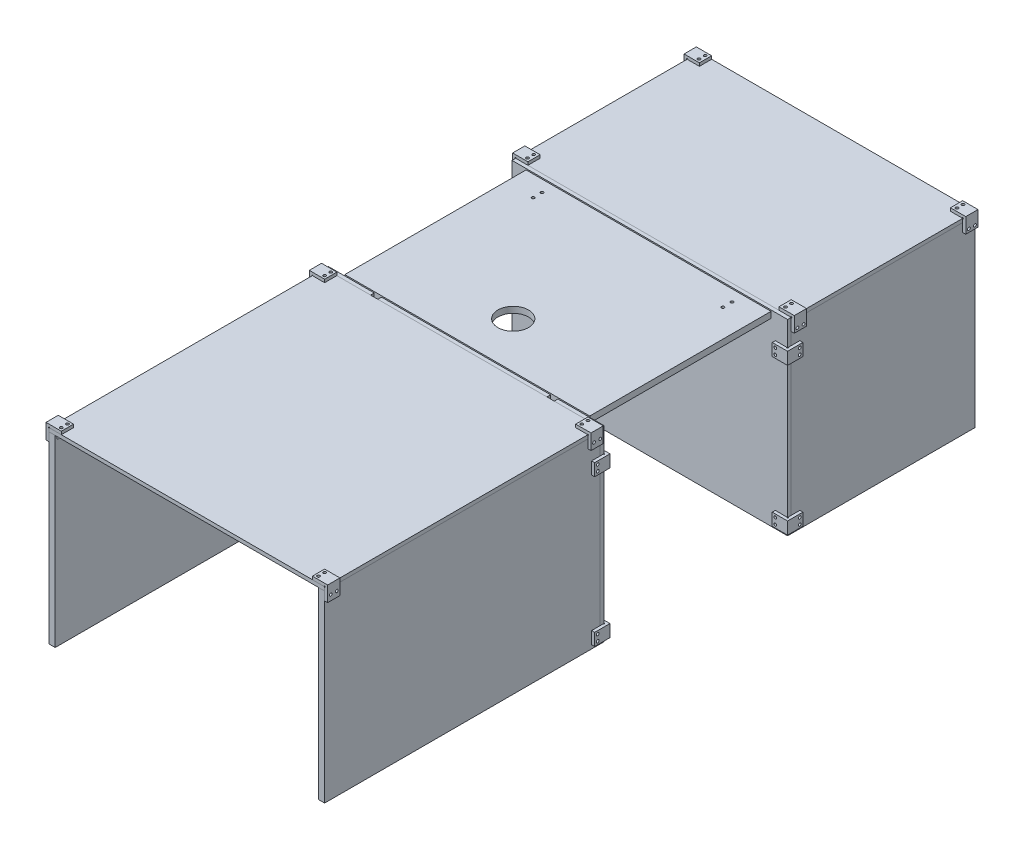
from build123d import *

# Parameters (mm, degrees)
SKETCH1_W                 = 450
SKETCH1_H                 = 300
BOSS_EXTRUDE1_DEPTH       = 10
SKETCH1_W_2               = 300
BOSS_EXTRUDE1_2_DEPTH     = 10
SKETCH1_3_W               = 450
SKETCH1_3_H               = 6
BOSS_EXTRUDE2_DEPTH       = 450
SKETCH1_3_W_2             = 300
BOSS_EXTRUDE2_2_DEPTH     = 450
BOSS_EXTRUDE3_START       = 450
SKETCH1_4_W               = 450
SKETCH1_4_H               = 300
BOSS_EXTRUDE3_DEPTH       = 10
SKETCH1_4_W_2             = 300
BOSS_EXTRUDE3_2_DEPTH     = 10
BOSS_EXTRUDE4_DEPTH       = 450
BOSS_EXTRUDE4_2_DEPTH     = 450
BOSS_EXTRUDE5_DEPTH       = 200
BOSS_EXTRUDE5_DEPTH_BACK  = 200
SKETCH2_W                 = 296
SKETCH2_H                 = 10
BOSS_EXTRUDE6_DEPTH       = 20
BOSS_EXTRUDE6_2_DEPTH     = 20
BOSS_EXTRUDE7_START       = -430
BOSS_EXTRUDE7_DEPTH       = 20
BOSS_EXTRUDE7_2_DEPTH     = 20
BOSS_EXTRUDE8_START       = -1062
BOSS_EXTRUDE8_DEPTH       = 20
BOSS_EXTRUDE8_2_DEPTH     = 20
BOSS_EXTRUDE9_START       = -762
BOSS_EXTRUDE9_DEPTH       = 20
BOSS_EXTRUDE9_2_DEPTH     = 20
BOSS_EXTRUDE10_START      = -40
BOSS_EXTRUDE10_DEPTH      = 20
BOSS_EXTRUDE10_2_DEPTH    = 20
BOSS_EXTRUDE10_3_DEPTH    = 20
BOSS_EXTRUDE10_4_DEPTH    = 20
BOSS_EXTRUDE11_START      = -300
BOSS_EXTRUDE11_DEPTH      = 20
BOSS_EXTRUDE11_2_DEPTH    = 20
BOSS_EXTRUDE11_3_DEPTH    = 20
BOSS_EXTRUDE11_4_DEPTH    = 20
CUT_EXTRUDE1_DEPTH        = 1197.490702012
CUT_EXTRUDE1_DEPTH_BACK   = 1197.490702012
SKETCH6_R                 = 2.25
CUT_EXTRUDE2_DEPTH        = 1196.200819946
CUT_EXTRUDE2_DEPTH_BACK   = 1196.200819946
SKETCH7_R                 = 2.25
CUT_EXTRUDE3_DEPTH        = 820.134909523
CUT_EXTRUDE3_DEPTH_BACK   = 820.134909523
SKETCH8_R                 = 2.25
BOSS_EXTRUDE12_START      = 150
SKETCH9_R                 = 5
SKETCH9_R_2               = 3.15
BOSS_EXTRUDE12_DEPTH      = 10
BOSS_EXTRUDE13_START      = 150
SKETCH9_3_R               = 5
SKETCH9_3_R_2             = 3.15
BOSS_EXTRUDE13_DEPTH      = 10
BOSS_EXTRUDE14_START      = -150
SKETCH9_4_R               = 5
SKETCH9_4_R_2             = 3.15
BOSS_EXTRUDE14_DEPTH      = 10
BOSS_EXTRUDE15_START      = -150
SKETCH9_5_R               = 5
SKETCH9_5_R_2             = 3.15
BOSS_EXTRUDE15_DEPTH      = 10
FILLET1_R                 = 10
FILLET2_R                 = 10
FILLET3_R                 = 10
FILLET4_R                 = 10
BOSS_EXTRUDE16_DEPTH      = 10
BOSS_EXTRUDE16_DEPTH_BACK = 10
CUT_EXTRUDE4_START        = 150
SKETCH11_W                = 6
SKETCH11_H                = 30
CUT_EXTRUDE4_DEPTH        = 12
CUT_EXTRUDE5_START        = -150
SKETCH11_2_W              = 6
SKETCH11_2_H              = 30
CUT_EXTRUDE5_DEPTH        = 12
BOSS_EXTRUDE17_START      = 139
BOSS_EXTRUDE17_DEPTH      = 10
BOSS_EXTRUDE18_START      = -139
BOSS_EXTRUDE18_DEPTH      = 10
SKETCH13_R                = 2.25
CUT_EXTRUDE6_DEPTH        = 828.305868467
CUT_EXTRUDE7_DEPTH        = 1192.448698014
CUT_EXTRUDE7_DEPTH_BACK   = 1192.448698014
SKETCH14_R                = 2.25
CUT_EXTRUDE8_DEPTH        = 20
CUT_EXTRUDE8_DEPTH_BACK   = 10
SKETCH15_R                = 2.25
SKETCH16_R                = 25
CUT_EXTRUDE9_DEPTH        = 10


with BuildPart() as part:
    # Sketch1 → Boss-Extrude1 (new body)
    with BuildSketch(Plane(origin=(0, 0, 0), x_dir=(0, 0, -1), z_dir=(1, 0, 0))):
        with Locations((225, 150)):
            Rectangle(SKETCH1_W, SKETCH1_H)
    extrude(amount=BOSS_EXTRUDE1_DEPTH)


with BuildPart() as body_2:
    # Sketch1 → Boss-Extrude1 2 (new body)
    with BuildSketch(Plane(origin=(0, 0, 0), x_dir=(0, 0, -1), z_dir=(1, 0, 0))):
        with Locations((912, 150)):
            Rectangle(SKETCH1_W_2, SKETCH1_H)
    extrude(amount=BOSS_EXTRUDE1_2_DEPTH)


with BuildPart() as body_3:
    # Sketch1<3> → Boss-Extrude2 (new body)
    with BuildSketch(Plane(origin=(0, 0, 0), x_dir=(0, 0, -1), z_dir=(1, 0, 0))):
        with Locations((225, 303)):
            Rectangle(SKETCH1_3_W, SKETCH1_3_H)
    extrude(amount=BOSS_EXTRUDE2_DEPTH)


with BuildPart() as body_4:
    # Sketch1<3> → Boss-Extrude2 2 (new body)
    with BuildSketch(Plane(origin=(0, 0, 0), x_dir=(0, 0, -1), z_dir=(1, 0, 0))):
        with Locations((912, 303)):
            Rectangle(SKETCH1_3_W_2, SKETCH1_3_H)
    extrude(amount=BOSS_EXTRUDE2_2_DEPTH)


with BuildPart() as body_5:
    # Sketch1<4> → Boss-Extrude3 (new body)
    with BuildSketch(Plane(origin=(0, 0, 0), x_dir=(0, 0, -1), z_dir=(1, 0, 0)).offset(BOSS_EXTRUDE3_START)):
        with Locations((225, 150)):
            Rectangle(SKETCH1_4_W, SKETCH1_4_H)
    extrude(amount=-BOSS_EXTRUDE3_DEPTH)


with BuildPart() as body_6:
    # Sketch1<4> → Boss-Extrude3 2 (new body)
    with BuildSketch(Plane(origin=(0, 0, 0), x_dir=(0, 0, -1), z_dir=(1, 0, 0)).offset(BOSS_EXTRUDE3_START)):
        with Locations((912, 150)):
            Rectangle(SKETCH1_4_W_2, SKETCH1_4_H)
    extrude(amount=-BOSS_EXTRUDE3_2_DEPTH)


with BuildPart() as body_7:
    # Sketch1<5> → Boss-Extrude4 (new body)
    with BuildSketch(Plane(origin=(0, 0, 0), x_dir=(0, 0, -1), z_dir=(1, 0, 0))):
        Polygon((456, 306), (456, 0), (450, 0), (450, 300), (450, 306), align=None)
    extrude(amount=BOSS_EXTRUDE4_DEPTH)


with BuildPart() as body_8:
    # Sketch1<5> → Boss-Extrude4 2 (new body)
    with BuildSketch(Plane(origin=(0, 0, 0), x_dir=(0, 0, -1), z_dir=(1, 0, 0))):
        Polygon((762, 306), (756, 306), (756, 0), (762, 0), (762, 300), align=None)
    extrude(amount=BOSS_EXTRUDE4_2_DEPTH)


with BuildPart() as body_9:
    # Sketch2 → Boss-Extrude5 (new, two sides: drawn at the far end of the back side and taken through both)
    with BuildSketch(Plane.ZY.offset(-225).offset(-BOSS_EXTRUDE5_DEPTH_BACK)):
        with Locations((-606, 301)):
            Rectangle(SKETCH2_W, SKETCH2_H)
    extrude(amount=BOSS_EXTRUDE5_DEPTH + BOSS_EXTRUDE5_DEPTH_BACK)


with BuildPart() as body_10:
    # Sketch3 → Boss-Extrude6 (new body)
    with BuildSketch(Plane.XY):
        with BuildLine():
            Line((430, 306), (430, 311))
            Line((430, 311), (455, 311))
            Line((455, 311), (455, 286))
            Line((455, 286), (450, 286))
            Line((450, 286), (450, 305))
            ThreePointArc((450, 305), (450.707106781, 306.707106781), (449, 306))
            Line((449, 306), (430, 306))
        make_face()
    extrude(amount=-BOSS_EXTRUDE6_DEPTH)


with BuildPart() as body_11:
    # Sketch3 → Boss-Extrude6 2 (new body)
    with BuildSketch(Plane.XY):
        with BuildLine():
            Line((1, 306), (20, 306))
            Line((20, 306), (20, 311))
            Line((20, 311), (-5, 311))
            Line((-5, 311), (-5, 286))
            Line((-5, 286), (0, 286))
            Line((0, 286), (0, 305))
            ThreePointArc((0, 305), (-0.707106781, 306.707106781), (1, 306))
        make_face()
    extrude(amount=-BOSS_EXTRUDE6_2_DEPTH)


with BuildPart() as body_12:
    # Sketch3<2> → Boss-Extrude7 (new body)
    with BuildSketch(Plane.XY.offset(BOSS_EXTRUDE7_START)):
        with BuildLine():
            Line((430, 306), (430, 311))
            Line((430, 311), (455, 311))
            Line((455, 311), (455, 286))
            Line((455, 286), (450, 286))
            Line((450, 286), (450, 305))
            ThreePointArc((450, 305), (450.707106781, 306.707106781), (449, 306))
            Line((449, 306), (430, 306))
        make_face()
    extrude(amount=-BOSS_EXTRUDE7_DEPTH)


with BuildPart() as body_13:
    # Sketch3<2> → Boss-Extrude7 2 (new body)
    with BuildSketch(Plane.XY.offset(BOSS_EXTRUDE7_START)):
        with BuildLine():
            Line((1, 306), (20, 306))
            Line((20, 306), (20, 311))
            Line((20, 311), (-5, 311))
            Line((-5, 311), (-5, 286))
            Line((-5, 286), (0, 286))
            Line((0, 286), (0, 305))
            ThreePointArc((0, 305), (-0.707106781, 306.707106781), (1, 306))
        make_face()
    extrude(amount=-BOSS_EXTRUDE7_2_DEPTH)


with BuildPart() as body_14:
    # Sketch3<3> → Boss-Extrude8 (new body)
    with BuildSketch(Plane.XY.offset(BOSS_EXTRUDE8_START)):
        with BuildLine():
            Line((430, 306), (430, 311))
            Line((430, 311), (455, 311))
            Line((455, 311), (455, 286))
            Line((455, 286), (450, 286))
            Line((450, 286), (450, 305))
            ThreePointArc((450, 305), (450.707106781, 306.707106781), (449, 306))
            Line((449, 306), (430, 306))
        make_face()
    extrude(amount=BOSS_EXTRUDE8_DEPTH)


with BuildPart() as body_15:
    # Sketch3<3> → Boss-Extrude8 2 (new body)
    with BuildSketch(Plane.XY.offset(BOSS_EXTRUDE8_START)):
        with BuildLine():
            Line((1, 306), (20, 306))
            Line((20, 306), (20, 311))
            Line((20, 311), (-5, 311))
            Line((-5, 311), (-5, 286))
            Line((-5, 286), (0, 286))
            Line((0, 286), (0, 305))
            ThreePointArc((0, 305), (-0.707106781, 306.707106781), (1, 306))
        make_face()
    extrude(amount=BOSS_EXTRUDE8_2_DEPTH)


with BuildPart() as body_16:
    # Sketch3<4> → Boss-Extrude9 (new body)
    with BuildSketch(Plane.XY.offset(BOSS_EXTRUDE9_START)):
        with BuildLine():
            Line((430, 306), (430, 311))
            Line((430, 311), (455, 311))
            Line((455, 311), (455, 286))
            Line((455, 286), (450, 286))
            Line((450, 286), (450, 305))
            ThreePointArc((450, 305), (450.707106781, 306.707106781), (449, 306))
            Line((449, 306), (430, 306))
        make_face()
    extrude(amount=-BOSS_EXTRUDE9_DEPTH)


with BuildPart() as body_17:
    # Sketch3<4> → Boss-Extrude9 2 (new body)
    with BuildSketch(Plane.XY.offset(BOSS_EXTRUDE9_START)):
        with BuildLine():
            Line((1, 306), (20, 306))
            Line((20, 306), (20, 311))
            Line((20, 311), (-5, 311))
            Line((-5, 311), (-5, 286))
            Line((-5, 286), (0, 286))
            Line((0, 286), (0, 305))
            ThreePointArc((0, 305), (-0.707106781, 306.707106781), (1, 306))
        make_face()
    extrude(amount=-BOSS_EXTRUDE9_2_DEPTH)


with BuildPart() as body_18:
    # Sketch5 → Boss-Extrude10 (new body)
    with BuildSketch(Plane(origin=(0, 306, 0), x_dir=(1, 0, 0), z_dir=(0, 1, 0)).offset(BOSS_EXTRUDE10_START)):
        with BuildLine():
            Line((430, 756), (449, 756))
            ThreePointArc((449, 756), (450.707106781, 755.292893219), (450, 757))
            Line((450, 757), (450, 776))
            Line((450, 776), (455, 776))
            Line((455, 776), (455, 751))
            Line((455, 751), (430, 751))
            Line((430, 751), (430, 756))
        make_face()
    extrude(amount=-BOSS_EXTRUDE10_DEPTH)


with BuildPart() as body_19:
    # Sketch5 → Boss-Extrude10 2 (new body)
    with BuildSketch(Plane(origin=(0, 306, 0), x_dir=(1, 0, 0), z_dir=(0, 1, 0)).offset(BOSS_EXTRUDE10_START)):
        with BuildLine():
            Line((0, 757), (0, 776))
            Line((0, 776), (-5, 776))
            Line((-5, 776), (-5, 751))
            Line((-5, 751), (20, 751))
            Line((20, 751), (20, 756))
            Line((20, 756), (1, 756))
            ThreePointArc((1, 756), (-0.707106781, 755.292893219), (0, 757))
        make_face()
    extrude(amount=-BOSS_EXTRUDE10_2_DEPTH)


with BuildPart() as body_20:
    # Sketch5 → Boss-Extrude10 3 (new body)
    with BuildSketch(Plane(origin=(0, 306, 0), x_dir=(1, 0, 0), z_dir=(0, 1, 0)).offset(BOSS_EXTRUDE10_START)):
        with BuildLine():
            Line((20, 456), (1, 456))
            ThreePointArc((1, 456), (-0.707106781, 456.707106781), (0, 455))
            Line((0, 455), (0, 436))
            Line((0, 436), (-5, 436))
            Line((-5, 436), (-5, 461))
            Line((-5, 461), (20, 461))
            Line((20, 461), (20, 456))
        make_face()
    extrude(amount=-BOSS_EXTRUDE10_3_DEPTH)


with BuildPart() as body_21:
    # Sketch5 → Boss-Extrude10 4 (new body)
    with BuildSketch(Plane(origin=(0, 306, 0), x_dir=(1, 0, 0), z_dir=(0, 1, 0)).offset(BOSS_EXTRUDE10_START)):
        with BuildLine():
            Line((450, 455), (450, 436))
            Line((450, 436), (455, 436))
            Line((455, 436), (455, 461))
            Line((455, 461), (430, 461))
            Line((430, 461), (430, 456))
            Line((430, 456), (449, 456))
            ThreePointArc((449, 456), (450.707106781, 456.707106781), (450, 455))
        make_face()
    extrude(amount=-BOSS_EXTRUDE10_4_DEPTH)


with BuildPart() as body_22:
    # Sketch5<3> → Boss-Extrude11 (new body)
    with BuildSketch(Plane(origin=(0, 306, 0), x_dir=(1, 0, 0), z_dir=(0, 1, 0)).offset(BOSS_EXTRUDE11_START)):
        with BuildLine():
            Line((430, 756), (449, 756))
            ThreePointArc((449, 756), (450.707106781, 755.292893219), (450, 757))
            Line((450, 757), (450, 776))
            Line((450, 776), (455, 776))
            Line((455, 776), (455, 751))
            Line((455, 751), (430, 751))
            Line((430, 751), (430, 756))
        make_face()
    extrude(amount=BOSS_EXTRUDE11_DEPTH)


with BuildPart() as body_23:
    # Sketch5<3> → Boss-Extrude11 2 (new body)
    with BuildSketch(Plane(origin=(0, 306, 0), x_dir=(1, 0, 0), z_dir=(0, 1, 0)).offset(BOSS_EXTRUDE11_START)):
        with BuildLine():
            Line((0, 757), (0, 776))
            Line((0, 776), (-5, 776))
            Line((-5, 776), (-5, 751))
            Line((-5, 751), (20, 751))
            Line((20, 751), (20, 756))
            Line((20, 756), (1, 756))
            ThreePointArc((1, 756), (-0.707106781, 755.292893219), (0, 757))
        make_face()
    extrude(amount=BOSS_EXTRUDE11_2_DEPTH)


with BuildPart() as body_24:
    # Sketch5<3> → Boss-Extrude11 3 (new body)
    with BuildSketch(Plane(origin=(0, 306, 0), x_dir=(1, 0, 0), z_dir=(0, 1, 0)).offset(BOSS_EXTRUDE11_START)):
        with BuildLine():
            Line((20, 456), (1, 456))
            ThreePointArc((1, 456), (-0.707106781, 456.707106781), (0, 455))
            Line((0, 455), (0, 436))
            Line((0, 436), (-5, 436))
            Line((-5, 436), (-5, 461))
            Line((-5, 461), (20, 461))
            Line((20, 461), (20, 456))
        make_face()
    extrude(amount=BOSS_EXTRUDE11_3_DEPTH)


with BuildPart() as body_25:
    # Sketch5<3> → Boss-Extrude11 4 (new body)
    with BuildSketch(Plane(origin=(0, 306, 0), x_dir=(1, 0, 0), z_dir=(0, 1, 0)).offset(BOSS_EXTRUDE11_START)):
        with BuildLine():
            Line((450, 455), (450, 436))
            Line((450, 436), (455, 436))
            Line((455, 436), (455, 461))
            Line((455, 461), (430, 461))
            Line((430, 461), (430, 456))
            Line((430, 456), (449, 456))
            ThreePointArc((449, 456), (450.707106781, 456.707106781), (450, 455))
        make_face()
    extrude(amount=BOSS_EXTRUDE11_4_DEPTH)


with BuildPart() as cut_extrude1_tool:
    # Sketch6 → Cut-Extrude1 (new, two sides: drawn at the far end of the back side and taken through both)
    with BuildSketch(Plane.ZY.offset(-CUT_EXTRUDE1_DEPTH_BACK)):
        with Locations((-445, 295)):
            Circle(SKETCH6_R)
        with Locations((-435, 295)):
            Circle(SKETCH6_R)
        with Locations((-5, 295)):
            Circle(SKETCH6_R)
        with Locations((-15, 295)):
            Circle(SKETCH6_R)
        with Locations((-767.10754132, 291.106459384)):
            Circle(SKETCH6_R)
        with Locations((-777.021627728, 291.106459384)):
            Circle(SKETCH6_R)
        with Locations((-1047.162736779, 291.106459384)):
            Circle(SKETCH6_R)
        with Locations((-1056.996509994, 291.106459384)):
            Circle(SKETCH6_R)
        with Locations((-441.070704006, 260.873069891)):
            Circle(SKETCH6_R)
        with Locations((-441.070704006, 251.230238331)):
            Circle(SKETCH6_R)
        with Locations((-441.070704006, 20.979543882)):
            Circle(SKETCH6_R)
        with Locations((-441.070704006, 11.003439354)):
            Circle(SKETCH6_R)
        with Locations((-770.929295994, 11.003439354)):
            Circle(SKETCH6_R)
        with Locations((-770.929295994, 20.979543882)):
            Circle(SKETCH6_R)
        with Locations(Location((-770.929295994, 251.230238331, 0), (0, 0, 180))):
            Circle(SKETCH6_R)
        with Locations(Location((-770.929295994, 260.873069891, 0), (0, 0, 180))):
            Circle(SKETCH6_R)
    extrude(amount=CUT_EXTRUDE1_DEPTH + CUT_EXTRUDE1_DEPTH_BACK)


with BuildPart() as part_1:
    add(part.part)

    # Cut-Extrude1: cut by cut_extrude1_tool
    add(cut_extrude1_tool.part, mode=Mode.SUBTRACT)


with BuildPart() as body_2_1:
    add(body_2.part)

    # Cut-Extrude1: cut by cut_extrude1_tool
    add(cut_extrude1_tool.part, mode=Mode.SUBTRACT)


with BuildPart() as body_5_1:
    add(body_5.part)

    # Cut-Extrude1: cut by cut_extrude1_tool
    add(cut_extrude1_tool.part, mode=Mode.SUBTRACT)


with BuildPart() as body_6_1:
    add(body_6.part)

    # Cut-Extrude1: cut by cut_extrude1_tool
    add(cut_extrude1_tool.part, mode=Mode.SUBTRACT)


with BuildPart() as body_10_1:
    add(body_10.part)

    # Cut-Extrude1: cut by cut_extrude1_tool
    add(cut_extrude1_tool.part, mode=Mode.SUBTRACT)


with BuildPart() as body_11_1:
    add(body_11.part)

    # Cut-Extrude1: cut by cut_extrude1_tool
    add(cut_extrude1_tool.part, mode=Mode.SUBTRACT)


with BuildPart() as body_12_1:
    add(body_12.part)

    # Cut-Extrude1: cut by cut_extrude1_tool
    add(cut_extrude1_tool.part, mode=Mode.SUBTRACT)


with BuildPart() as body_13_1:
    add(body_13.part)

    # Cut-Extrude1: cut by cut_extrude1_tool
    add(cut_extrude1_tool.part, mode=Mode.SUBTRACT)


with BuildPart() as body_14_1:
    add(body_14.part)

    # Cut-Extrude1: cut by cut_extrude1_tool
    add(cut_extrude1_tool.part, mode=Mode.SUBTRACT)


with BuildPart() as body_15_1:
    add(body_15.part)

    # Cut-Extrude1: cut by cut_extrude1_tool
    add(cut_extrude1_tool.part, mode=Mode.SUBTRACT)


with BuildPart() as body_16_1:
    add(body_16.part)

    # Cut-Extrude1: cut by cut_extrude1_tool
    add(cut_extrude1_tool.part, mode=Mode.SUBTRACT)


with BuildPart() as body_17_1:
    add(body_17.part)

    # Cut-Extrude1: cut by cut_extrude1_tool
    add(cut_extrude1_tool.part, mode=Mode.SUBTRACT)


with BuildPart() as body_18_1:
    add(body_18.part)

    # Cut-Extrude1: cut by cut_extrude1_tool
    add(cut_extrude1_tool.part, mode=Mode.SUBTRACT)


with BuildPart() as body_19_1:
    add(body_19.part)

    # Cut-Extrude1: cut by cut_extrude1_tool
    add(cut_extrude1_tool.part, mode=Mode.SUBTRACT)


with BuildPart() as body_20_1:
    add(body_20.part)

    # Cut-Extrude1: cut by cut_extrude1_tool
    add(cut_extrude1_tool.part, mode=Mode.SUBTRACT)


with BuildPart() as body_21_1:
    add(body_21.part)

    # Cut-Extrude1: cut by cut_extrude1_tool
    add(cut_extrude1_tool.part, mode=Mode.SUBTRACT)


with BuildPart() as body_22_1:
    add(body_22.part)

    # Cut-Extrude1: cut by cut_extrude1_tool
    add(cut_extrude1_tool.part, mode=Mode.SUBTRACT)


with BuildPart() as body_23_1:
    add(body_23.part)

    # Cut-Extrude1: cut by cut_extrude1_tool
    add(cut_extrude1_tool.part, mode=Mode.SUBTRACT)


with BuildPart() as body_24_1:
    add(body_24.part)

    # Cut-Extrude1: cut by cut_extrude1_tool
    add(cut_extrude1_tool.part, mode=Mode.SUBTRACT)


with BuildPart() as body_25_1:
    add(body_25.part)

    # Cut-Extrude1: cut by cut_extrude1_tool
    add(cut_extrude1_tool.part, mode=Mode.SUBTRACT)


with BuildPart() as cut_extrude2_tool:
    # Sketch7 → Cut-Extrude2 (new, two sides: drawn at the far end of the back side and taken through both)
    with BuildSketch(Plane(origin=(0, 306, 0), x_dir=(1, 0, 0), z_dir=(0, 1, 0)).offset(-CUT_EXTRUDE2_DEPTH_BACK)):
        with Locations(Location((14.447912615, 777, 0), (0, 0, 270))):
            Circle(SKETCH7_R)
        with Locations(Location((14.447912615, 767, 0), (0, 0, 270))):
            Circle(SKETCH7_R)
        with Locations(Location((435.552087385, 767, 0), (0, 0, 90))):
            Circle(SKETCH7_R)
        with Locations(Location((435.552087385, 777, 0), (0, 0, 90))):
            Circle(SKETCH7_R)
        with Locations(Location((435.552087385, 1047, 0), (0, 0, 270))):
            Circle(SKETCH7_R)
        with Locations(Location((435.552087385, 1057, 0), (0, 0, 270))):
            Circle(SKETCH7_R)
        with Locations(Location((14.447912615, 1057, 0), (0, 0, 270))):
            Circle(SKETCH7_R)
        with Locations(Location((14.447912615, 1047, 0), (0, 0, 270))):
            Circle(SKETCH7_R)
        with Locations(Location((15, 445, 0), (0, 0, 270))):
            Circle(SKETCH7_R)
        with Locations(Location((15, 435, 0), (0, 0, 270))):
            Circle(SKETCH7_R)
        with Locations(Location((15, 5, 0), (0, 0, 270))):
            Circle(SKETCH7_R)
        with Locations(Location((15, 15, 0), (0, 0, 270))):
            Circle(SKETCH7_R)
        with Locations(Location((435, 15, 0), (0, 0, 90))):
            Circle(SKETCH7_R)
        with Locations(Location((435, 5, 0), (0, 0, 90))):
            Circle(SKETCH7_R)
        with Locations(Location((435, 435, 0), (0, 0, 270))):
            Circle(SKETCH7_R)
        with Locations(Location((435, 445, 0), (0, 0, 270))):
            Circle(SKETCH7_R)
    extrude(amount=CUT_EXTRUDE2_DEPTH + CUT_EXTRUDE2_DEPTH_BACK)


with BuildPart() as body_3_1:
    add(body_3.part)

    # Cut-Extrude2: cut by cut_extrude2_tool
    add(cut_extrude2_tool.part, mode=Mode.SUBTRACT)


with BuildPart() as body_4_1:
    add(body_4.part)

    # Cut-Extrude2: cut by cut_extrude2_tool
    add(cut_extrude2_tool.part, mode=Mode.SUBTRACT)


with BuildPart() as body_10_2:
    add(body_10_1.part)

    # Cut-Extrude2: cut by cut_extrude2_tool
    add(cut_extrude2_tool.part, mode=Mode.SUBTRACT)


with BuildPart() as body_11_2:
    add(body_11_1.part)

    # Cut-Extrude2: cut by cut_extrude2_tool
    add(cut_extrude2_tool.part, mode=Mode.SUBTRACT)


with BuildPart() as body_12_2:
    add(body_12_1.part)

    # Cut-Extrude2: cut by cut_extrude2_tool
    add(cut_extrude2_tool.part, mode=Mode.SUBTRACT)


with BuildPart() as body_13_2:
    add(body_13_1.part)

    # Cut-Extrude2: cut by cut_extrude2_tool
    add(cut_extrude2_tool.part, mode=Mode.SUBTRACT)


with BuildPart() as body_14_2:
    add(body_14_1.part)

    # Cut-Extrude2: cut by cut_extrude2_tool
    add(cut_extrude2_tool.part, mode=Mode.SUBTRACT)


with BuildPart() as body_15_2:
    add(body_15_1.part)

    # Cut-Extrude2: cut by cut_extrude2_tool
    add(cut_extrude2_tool.part, mode=Mode.SUBTRACT)


with BuildPart() as body_16_2:
    add(body_16_1.part)

    # Cut-Extrude2: cut by cut_extrude2_tool
    add(cut_extrude2_tool.part, mode=Mode.SUBTRACT)


with BuildPart() as body_17_2:
    add(body_17_1.part)

    # Cut-Extrude2: cut by cut_extrude2_tool
    add(cut_extrude2_tool.part, mode=Mode.SUBTRACT)


with BuildPart() as cut_extrude3_tool:
    # Sketch8 → Cut-Extrude3 (new, two sides: drawn at the far end of the back side and taken through both)
    with BuildSketch(Plane(origin=(0, 0, -456), x_dir=(-1, 0, 0), z_dir=(0, 0, -1)).offset(-CUT_EXTRUDE3_DEPTH_BACK)):
        with Locations(Location((-435, 261.010557179, 0), (0, 0, 180))):
            Circle(SKETCH8_R)
        with Locations(Location((-435, 251.01711881, 0), (0, 0, 180))):
            Circle(SKETCH8_R)
        with Locations((-15, 251.01711881)):
            Circle(SKETCH8_R)
        with Locations((-15, 261.010557179)):
            Circle(SKETCH8_R)
        with Locations(Location((-15, 10.989442821, 0), (0, 0, 180))):
            Circle(SKETCH8_R)
        with Locations(Location((-15, 20.98288119, 0), (0, 0, 180))):
            Circle(SKETCH8_R)
        with Locations((-435, 20.98288119)):
            Circle(SKETCH8_R)
        with Locations((-435, 10.989442821)):
            Circle(SKETCH8_R)
    extrude(amount=CUT_EXTRUDE3_DEPTH + CUT_EXTRUDE3_DEPTH_BACK)


with BuildPart() as body_7_1:
    add(body_7.part)

    # Cut-Extrude3: cut by cut_extrude3_tool
    add(cut_extrude3_tool.part, mode=Mode.SUBTRACT)

    # Sketch11 → Cut-Extrude4 (cut)
    with BuildSketch(Plane.ZY.offset(-225).offset(CUT_EXTRUDE4_START)):
        with Locations((-453, 291)):
            Rectangle(SKETCH11_W, SKETCH11_H)
    extrude(amount=-CUT_EXTRUDE4_DEPTH, mode=Mode.SUBTRACT)

    # Sketch11<2> → Cut-Extrude5 (cut)
    with BuildSketch(Plane.ZY.offset(-225).offset(CUT_EXTRUDE5_START)):
        with Locations((-453, 291)):
            Rectangle(SKETCH11_2_W, SKETCH11_2_H)
    extrude(amount=CUT_EXTRUDE5_DEPTH, mode=Mode.SUBTRACT)


with BuildPart() as body_8_1:
    add(body_8.part)

    # Cut-Extrude3: cut by cut_extrude3_tool
    add(cut_extrude3_tool.part, mode=Mode.SUBTRACT)


with BuildPart() as body_18_2:
    add(body_18_1.part)

    # Cut-Extrude3: cut by cut_extrude3_tool
    add(cut_extrude3_tool.part, mode=Mode.SUBTRACT)


with BuildPart() as body_19_2:
    add(body_19_1.part)

    # Cut-Extrude3: cut by cut_extrude3_tool
    add(cut_extrude3_tool.part, mode=Mode.SUBTRACT)


with BuildPart() as body_20_2:
    add(body_20_1.part)

    # Cut-Extrude3: cut by cut_extrude3_tool
    add(cut_extrude3_tool.part, mode=Mode.SUBTRACT)


with BuildPart() as body_21_2:
    add(body_21_1.part)

    # Cut-Extrude3: cut by cut_extrude3_tool
    add(cut_extrude3_tool.part, mode=Mode.SUBTRACT)


with BuildPart() as body_22_2:
    add(body_22_1.part)

    # Cut-Extrude3: cut by cut_extrude3_tool
    add(cut_extrude3_tool.part, mode=Mode.SUBTRACT)


with BuildPart() as body_23_2:
    add(body_23_1.part)

    # Cut-Extrude3: cut by cut_extrude3_tool
    add(cut_extrude3_tool.part, mode=Mode.SUBTRACT)


with BuildPart() as body_24_2:
    add(body_24_1.part)

    # Cut-Extrude3: cut by cut_extrude3_tool
    add(cut_extrude3_tool.part, mode=Mode.SUBTRACT)


with BuildPart() as body_25_2:
    add(body_25_1.part)

    # Cut-Extrude3: cut by cut_extrude3_tool
    add(cut_extrude3_tool.part, mode=Mode.SUBTRACT)


with BuildPart() as body_26:
    # Sketch9 → Boss-Extrude12 (new body)
    # profile 1 of 2: a face of its own
    with BuildSketch(Plane.ZY.offset(-225).offset(BOSS_EXTRUDE12_START)):
        with BuildLine():
            ThreePointArc((-751, 284.378033583), (-753.133414264, 286.222951687), (-753.928932188, 288.928932188))
            Line((-753.928932188, 288.928932188), (-756, 288.928932188))
            Line((-756, 288.928932188), (-756, 255.498764557))
            Line((-756, 255.498764557), (-751, 255.498764557))
            Line((-751, 255.498764557), (-751, 284.378033583))
        make_face()
    # profile 2 of 2: a face of its own
    with BuildSketch(Plane.ZY.offset(-225).offset(BOSS_EXTRUDE12_START)):
        with Locations((-748.928932188, 288.928932188)):
            Circle(SKETCH9_R)
        with Locations((-748.928932188, 288.928932188)):
            Circle(SKETCH9_R_2, mode=Mode.SUBTRACT)
    extrude(amount=-BOSS_EXTRUDE12_DEPTH)

    # Fillet2
    # the kernel refuses this fillet: 10 mm, written as the material it adds along each edge
    with BuildSketch(Plane(origin=(75, 288.928932188, -753.928932188), x_dir=(0, 0.9552376435694797, 0.2958395583890496), z_dir=(1, 0, 0))) as fillet2_piece_1:
        with BuildLine():
            CenterArc((5.916791168, -9.552376436), FILLET2_R, 107.207887789, 23.556464309)
            Line((-0.612703787, -1.978361936), (-0.743293686, -1.826881646))
            ThreePointArc((-0.743293686, -1.826881646), (-0.497399422, -0.930013056), (-0.191047529, 0.059167912))
            Line((-0.191047529, 0.059167912), (0.059167912, 0.191047529))
            ThreePointArc((0.059167912, 0.191047529), (1.479197792, -0.023811782), (2.899227672, 0.191047529))
            Line((2.899227672, 0.191047529), (2.958395584, 0))
        make_face()
    extrude(amount=10)
    with BuildSketch(Plane(origin=(75, 284.378033583, -751), x_dir=(0, 0.06488765731923174, 0.9978925753444715), z_dir=(1, 0, 0))) as fillet2_piece_2:
        with BuildLine():
            CenterArc((9.448001367, 8.813842382), FILLET2_R, 183.720402764, 58.089393952)
            Line((-0.530924387, 8.164965809), (-0.730502902, 8.151988278))
            Line((-0.730502902, 8.151988278), (-0.199578515, -0.012977531))
            Line((-0.199578515, -0.012977531), (0.094480014, -0.176276848))
            ThreePointArc((0.094480014, -0.176276848), (2.362000342, 0.393078809), (4.62952067, -0.176276848))
            Line((4.62952067, -0.176276848), (4.724000683, 0))
        make_face()
    extrude(amount=10)


with BuildPart() as body_27:
    # Sketch9<3> → Boss-Extrude13 (new body)
    # profile 1 of 2: a face of its own
    with BuildSketch(Plane.ZY.offset(-225).offset(BOSS_EXTRUDE13_START)):
        with Locations((-748.928932188, 288.928932188)):
            Circle(SKETCH9_3_R)
        with Locations((-748.928932188, 288.928932188)):
            Circle(SKETCH9_3_R_2, mode=Mode.SUBTRACT)
    # profile 2 of 2: a face of its own
    with BuildSketch(Plane.ZY.offset(-225).offset(BOSS_EXTRUDE13_START)):
        with BuildLine():
            Line((-715.498764557, 291), (-715.498764557, 296))
            Line((-715.498764557, 296), (-748.928932188, 296))
            Line((-748.928932188, 296), (-748.928932188, 293.928932188))
            ThreePointArc((-748.928932188, 293.928932188), (-746.222951687, 293.133414264), (-744.378033583, 291))
            Line((-744.378033583, 291), (-715.498764557, 291))
        make_face()
    extrude(amount=BOSS_EXTRUDE13_DEPTH)

    # Fillet1
    # the kernel refuses this fillet: 10 mm, written as the material it adds along each edge
    with BuildSketch(Plane(origin=(75, 293.928932188, -748.928932188), x_dir=(0, -0.29583955838909004, -0.955237643569467), z_dir=(-1, 0, 0))) as fillet1_piece_1:
        with BuildLine():
            CenterArc((5.916791168, -9.552376436), FILLET1_R, 107.207887789, 23.556464309)
            Line((-0.612703787, -1.978361936), (-0.743293686, -1.826881646))
            ThreePointArc((-0.743293686, -1.826881646), (-0.497399422, -0.930013056), (-0.191047529, 0.059167912))
            Line((-0.191047529, 0.059167912), (0.059167912, 0.191047529))
            ThreePointArc((0.059167912, 0.191047529), (1.479197792, -0.023811782), (2.899227672, 0.191047529))
            Line((2.899227672, 0.191047529), (2.958395584, 0))
        make_face()
    extrude(amount=10)
    with BuildSketch(Plane(origin=(75, 291, -744.378033583), x_dir=(0, -0.9978925753444723, -0.06488765731922132), z_dir=(-1, 0, 0))) as fillet1_piece_2:
        with BuildLine():
            CenterArc((9.448001367, 8.813842382), FILLET1_R, 183.720402764, 58.089393952)
            Line((-0.530924387, 8.164965809), (-0.730502902, 8.151988278))
            Line((-0.730502902, 8.151988278), (-0.199578515, -0.012977531))
            Line((-0.199578515, -0.012977531), (0.094480014, -0.176276848))
            ThreePointArc((0.094480014, -0.176276848), (2.362000342, 0.393078809), (4.62952067, -0.176276848))
            Line((4.62952067, -0.176276848), (4.724000683, 0))
        make_face()
    extrude(amount=10)


with BuildPart() as body_28:
    # Sketch9<4> → Boss-Extrude14 (new body)
    # profile 1 of 2: a face of its own
    with BuildSketch(Plane.ZY.offset(-225).offset(BOSS_EXTRUDE14_START)):
        with BuildLine():
            ThreePointArc((-751, 284.378033583), (-753.133414264, 286.222951687), (-753.928932188, 288.928932188))
            Line((-753.928932188, 288.928932188), (-756, 288.928932188))
            Line((-756, 288.928932188), (-756, 255.498764557))
            Line((-756, 255.498764557), (-751, 255.498764557))
            Line((-751, 255.498764557), (-751, 284.378033583))
        make_face()
    # profile 2 of 2: a face of its own
    with BuildSketch(Plane.ZY.offset(-225).offset(BOSS_EXTRUDE14_START)):
        with Locations((-748.928932188, 288.928932188)):
            Circle(SKETCH9_4_R)
        with Locations((-748.928932188, 288.928932188)):
            Circle(SKETCH9_4_R_2, mode=Mode.SUBTRACT)
    extrude(amount=BOSS_EXTRUDE14_DEPTH)

    # Fillet3
    # the kernel refuses this fillet: 10 mm, written as the material it adds along each edge
    with BuildSketch(Plane(origin=(375, 288.928932188, -753.928932188), x_dir=(0, 0.9552376435694797, 0.2958395583890496), z_dir=(-1, 0, 0))) as fillet3_piece_1:
        with BuildLine():
            CenterArc((5.916791168, 9.552376436), FILLET3_R, 229.235647902, 23.556464309)
            Line((-0.612703787, 1.978361936), (-0.743293686, 1.826881646))
            ThreePointArc((-0.743293686, 1.826881646), (-0.497399422, 0.930013056), (-0.191047529, -0.059167912))
            Line((-0.191047529, -0.059167912), (0.059167912, -0.191047529))
            ThreePointArc((0.059167912, -0.191047529), (1.479197792, 0.023811782), (2.899227672, -0.191047529))
            Line((2.899227672, -0.191047529), (2.958395584, 0))
        make_face()
    extrude(amount=10)
    with BuildSketch(Plane(origin=(375, 284.378033583, -751), x_dir=(0, 0.06488765731923174, 0.9978925753444715), z_dir=(-1, 0, 0))) as fillet3_piece_2:
        with BuildLine():
            CenterArc((9.448001367, -8.813842382), FILLET3_R, 118.190203284, 58.089393952)
            Line((-0.530924387, -8.164965809), (-0.730502902, -8.151988278))
            Line((-0.730502902, -8.151988278), (-0.199578515, 0.012977531))
            Line((-0.199578515, 0.012977531), (0.094480014, 0.176276848))
            ThreePointArc((0.094480014, 0.176276848), (2.362000342, -0.393078809), (4.62952067, 0.176276848))
            Line((4.62952067, 0.176276848), (4.724000683, 0))
        make_face()
    extrude(amount=10)


with BuildPart() as body_29:
    # Sketch9<5> → Boss-Extrude15 (new body)
    # profile 1 of 2: a face of its own
    with BuildSketch(Plane.ZY.offset(-225).offset(BOSS_EXTRUDE15_START)):
        with BuildLine():
            Line((-715.498764557, 291), (-715.498764557, 296))
            Line((-715.498764557, 296), (-748.928932188, 296))
            Line((-748.928932188, 296), (-748.928932188, 293.928932188))
            ThreePointArc((-748.928932188, 293.928932188), (-746.222951687, 293.133414264), (-744.378033583, 291))
            Line((-744.378033583, 291), (-715.498764557, 291))
        make_face()
    # profile 2 of 2: a face of its own
    with BuildSketch(Plane.ZY.offset(-225).offset(BOSS_EXTRUDE15_START)):
        with Locations((-748.928932188, 288.928932188)):
            Circle(SKETCH9_5_R)
        with Locations((-748.928932188, 288.928932188)):
            Circle(SKETCH9_5_R_2, mode=Mode.SUBTRACT)
    extrude(amount=-BOSS_EXTRUDE15_DEPTH)

    # Fillet4
    # the kernel refuses this fillet: 10 mm, written as the material it adds along each edge
    with BuildSketch(Plane(origin=(375, 293.928932188, -748.928932188), x_dir=(0, -0.29583955838909004, -0.955237643569467), z_dir=(1, 0, 0))) as fillet4_piece_1:
        with BuildLine():
            CenterArc((5.916791168, 9.552376436), FILLET4_R, 229.235647902, 23.556464309)
            Line((-0.612703787, 1.978361936), (-0.743293686, 1.826881646))
            ThreePointArc((-0.743293686, 1.826881646), (-0.497399422, 0.930013056), (-0.191047529, -0.059167912))
            Line((-0.191047529, -0.059167912), (0.059167912, -0.191047529))
            ThreePointArc((0.059167912, -0.191047529), (1.479197792, 0.023811782), (2.899227672, -0.191047529))
            Line((2.899227672, -0.191047529), (2.958395584, 0))
        make_face()
    extrude(amount=10)
    with BuildSketch(Plane(origin=(375, 291, -744.378033583), x_dir=(0, -0.9978925753444723, -0.06488765731922132), z_dir=(1, 0, 0))) as fillet4_piece_2:
        with BuildLine():
            CenterArc((9.448001367, -8.813842382), FILLET4_R, 118.190203284, 58.089393952)
            Line((-0.530924387, -8.164965809), (-0.730502902, -8.151988278))
            Line((-0.730502902, -8.151988278), (-0.199578515, 0.012977531))
            Line((-0.199578515, 0.012977531), (0.094480014, 0.176276848))
            ThreePointArc((0.094480014, 0.176276848), (2.362000342, -0.393078809), (4.62952067, 0.176276848))
            Line((4.62952067, 0.176276848), (4.724000683, 0))
        make_face()
    extrude(amount=10)


with BuildPart() as body_30:
    # Sketch10 → Boss-Extrude16 (new, two sides: drawn at the far end of the back side and taken through both)
    with BuildSketch(Plane.ZY.offset(-225).offset(-BOSS_EXTRUDE16_DEPTH_BACK)):
        with BuildLine():
            Line((-744.803847577, 292.803847577), (-722.393299574, 253.98763981))
            ThreePointArc((-722.393299574, 253.98763981), (-722.393299574, 248.98763981), (-726.723426593, 246.48763981))
            Line((-726.723426593, 246.48763981), (-749, 246.48763981))
            ThreePointArc((-749, 246.48763981), (-753.949747468, 248.537892342), (-756, 253.48763981))
            Line((-756, 253.48763981), (-756, 289.803847577))
            ThreePointArc((-756, 289.803847577), (-751.552914271, 295.599402535), (-744.803847577, 292.803847577))
        make_face()
        with BuildLine():
            Line((-748.267949192, 290.803847577), (-726.723426593, 253.48763981))
            ThreePointArc((-726.723426593, 253.48763981), (-726.723426593, 251.48763981), (-728.4554774, 250.48763981))
            Line((-728.4554774, 250.48763981), (-749, 250.48763981))
            ThreePointArc((-749, 250.48763981), (-751.121320344, 251.366319467), (-752, 253.48763981))
            Line((-752, 253.48763981), (-752, 289.803847577))
            ThreePointArc((-752, 289.803847577), (-750.51763809, 291.73569923), (-748.267949192, 290.803847577))
        make_face(mode=Mode.SUBTRACT)
    extrude(amount=BOSS_EXTRUDE16_DEPTH + BOSS_EXTRUDE16_DEPTH_BACK)


with BuildPart() as body_31:
    # Sketch12 → Boss-Extrude17 (new body)
    with BuildSketch(Plane.ZY.offset(-225).offset(BOSS_EXTRUDE17_START)):
        with BuildLine():
            ThreePointArc((-450.487253825, 287.677640912), (-452.353975066, 292.011249556), (-456, 295.006464783))
            Line((-456, 295.006464783), (-456, 291.487841824))
            ThreePointArc((-456, 291.487841824), (-454.322946331, 289.567707922), (-453.444735336, 287.174348638))
            Line((-453.444735336, 287.174348638), (-452.053657658, 279))
            Line((-452.053657658, 279), (-454.06024317, 279))
            Line((-454.06024317, 279), (-456, 283.310570733))
            Line((-456, 283.310570733), (-456, 276))
            Line((-456, 276), (-450, 276))
            Line((-450, 276), (-448.5, 276))
            Line((-448.5, 276), (-450.487253825, 287.677640912))
        make_face()
        with BuildLine():
            Line((-456, 291.487841824), (-456, 295.006464783))
            ThreePointArc((-456, 295.006464783), (-458.116697117, 295.748452386), (-460.345525528, 296))
            Line((-460.345525528, 296), (-465, 296))
            Line((-465, 296), (-456, 276))
            Line((-456, 276), (-456, 283.310570733))
            Line((-456, 283.310570733), (-460.36024317, 293))
            Line((-460.36024317, 293), (-460.345525528, 293))
            ThreePointArc((-460.345525528, 293), (-458.044970461, 292.611160744), (-456, 291.487841824))
        make_face()
        with BuildLine():
            Line((-448.5, 238), (-448.5, 276))
            Line((-448.5, 276), (-450, 276))
            Line((-450, 276), (-450, 216))
            Line((-450, 216), (-445, 216))
            Line((-445, 216), (-445, 236))
            Line((-445, 236), (-446.5, 236))
            ThreePointArc((-446.5, 236), (-447.914213562, 236.585786438), (-448.5, 238))
        make_face()
    extrude(amount=BOSS_EXTRUDE17_DEPTH)


with BuildPart() as body_32:
    # Sketch12<4> → Boss-Extrude18 (new body)
    with BuildSketch(Plane.ZY.offset(-225).offset(BOSS_EXTRUDE18_START)):
        with BuildLine():
            Line((-448.5, 238), (-448.5, 276))
            Line((-448.5, 276), (-450, 276))
            Line((-450, 276), (-450, 216))
            Line((-450, 216), (-445, 216))
            Line((-445, 216), (-445, 236))
            Line((-445, 236), (-446.5, 236))
            ThreePointArc((-446.5, 236), (-447.914213562, 236.585786438), (-448.5, 238))
        make_face()
        with BuildLine():
            ThreePointArc((-450.487253825, 287.677640912), (-452.353975066, 292.011249556), (-456, 295.006464783))
            Line((-456, 295.006464783), (-456, 291.487841824))
            ThreePointArc((-456, 291.487841824), (-454.322946331, 289.567707922), (-453.444735336, 287.174348638))
            Line((-453.444735336, 287.174348638), (-452.053657658, 279))
            Line((-452.053657658, 279), (-454.06024317, 279))
            Line((-454.06024317, 279), (-456, 283.310570733))
            Line((-456, 283.310570733), (-456, 276))
            Line((-456, 276), (-450, 276))
            Line((-450, 276), (-448.5, 276))
            Line((-448.5, 276), (-450.487253825, 287.677640912))
        make_face()
        with BuildLine():
            Line((-456, 291.487841824), (-456, 295.006464783))
            ThreePointArc((-456, 295.006464783), (-458.116697117, 295.748452386), (-460.345525528, 296))
            Line((-460.345525528, 296), (-465, 296))
            Line((-465, 296), (-456, 276))
            Line((-456, 276), (-456, 283.310570733))
            Line((-456, 283.310570733), (-460.36024317, 293))
            Line((-460.36024317, 293), (-460.345525528, 293))
            ThreePointArc((-460.345525528, 293), (-458.044970461, 292.611160744), (-456, 291.487841824))
        make_face()
    extrude(amount=-BOSS_EXTRUDE18_DEPTH)


with BuildPart() as cut_extrude6_tool:
    # Sketch13 → Cut-Extrude6 (new, through all)
    with BuildSketch(Plane.XY.offset(-445)):
        with Locations((369, 231.011303631)):
            Circle(SKETCH13_R)
        with Locations((369, 221.186877823)):
            Circle(SKETCH13_R)
        with Locations((81, 221.186877823)):
            Circle(SKETCH13_R)
        with Locations((81, 231.011303631)):
            Circle(SKETCH13_R)
    extrude(amount=-CUT_EXTRUDE6_DEPTH)


with BuildPart() as body_7_2:
    add(body_7_1.part)

    # Cut-Extrude6: cut by cut_extrude6_tool
    add(cut_extrude6_tool.part, mode=Mode.SUBTRACT)


with BuildPart() as body_32_1:
    add(body_32.part)

    # Cut-Extrude6: cut by cut_extrude6_tool
    add(cut_extrude6_tool.part, mode=Mode.SUBTRACT)


with BuildPart() as body_31_1:
    add(body_31.part)

    # Cut-Extrude6: cut by cut_extrude6_tool
    add(cut_extrude6_tool.part, mode=Mode.SUBTRACT)


with BuildPart() as cut_extrude7_tool:
    # Sketch14 → Cut-Extrude7 (new, two sides: drawn at the far end of the back side and taken through both)
    with BuildSketch(Plane.XZ.offset(-291).offset(-CUT_EXTRUDE7_DEPTH_BACK)):
        with Locations(Location((380, -720.498764557, 0), (0, 0, 270))):
            Circle(SKETCH14_R)
        with Locations(Location((380, -735.195824384, 0), (0, 0, 270))):
            Circle(SKETCH14_R)
        with Locations(Location((70, -735.195824384, 0), (0, 0, 333.612200039))):
            Circle(SKETCH14_R)
        with Locations(Location((70, -720.498764557, 0), (0, 0, 270))):
            Circle(SKETCH14_R)
    extrude(amount=CUT_EXTRUDE7_DEPTH + CUT_EXTRUDE7_DEPTH_BACK)


with BuildPart() as body_9_1:
    add(body_9.part)

    # Cut-Extrude7: cut by cut_extrude7_tool
    add(cut_extrude7_tool.part, mode=Mode.SUBTRACT)

    # Sketch16 → Cut-Extrude9 (cut)
    with BuildSketch(Plane(origin=(0, 306, 0), x_dir=(1, 0, 0), z_dir=(0, 1, 0))):
        with Locations(Location((225, 533, 0), (0, 0, 270))):
            Circle(SKETCH16_R)
    extrude(amount=-CUT_EXTRUDE9_DEPTH, mode=Mode.SUBTRACT)


with BuildPart() as body_27_1:
    add(body_27.part)

    # Cut-Extrude7: cut by cut_extrude7_tool
    add(cut_extrude7_tool.part, mode=Mode.SUBTRACT)


with BuildPart() as body_29_1:
    add(body_29.part)

    # Cut-Extrude7: cut by cut_extrude7_tool
    add(cut_extrude7_tool.part, mode=Mode.SUBTRACT)


with BuildPart() as cut_extrude8_tool:
    # Sketch15 → Cut-Extrude8 (new, two sides: drawn at the far end of the back side and taken through both)
    with BuildSketch(Plane(origin=(0, 0, -756), x_dir=(-1, 0, 0), z_dir=(0, 0, -1)).offset(-CUT_EXTRUDE8_DEPTH_BACK)):
        with Locations(Location((-370, 270.498764557, 0), (0, 0, 180))):
            Circle(SKETCH15_R)
        with Locations(Location((-370, 260.498764557, 0), (0, 0, 180))):
            Circle(SKETCH15_R)
        with Locations(Location((-80, 260.498764557, 0), (0, 0, 180))):
            Circle(SKETCH15_R)
        with Locations(Location((-80, 270.498764557, 0), (0, 0, 180))):
            Circle(SKETCH15_R)
        with Locations(Location((-225, 279.267949192, 0), (0, 0, 90))):
            Circle(SKETCH15_R)
        with Locations(Location((-225, 263.48763981, 0), (0, 0, 90))):
            Circle(SKETCH15_R)
    extrude(amount=CUT_EXTRUDE8_DEPTH + CUT_EXTRUDE8_DEPTH_BACK)


with BuildPart() as body_8_2:
    add(body_8_1.part)

    # Cut-Extrude8: cut by cut_extrude8_tool
    add(cut_extrude8_tool.part, mode=Mode.SUBTRACT)


with BuildPart() as body_26_1:
    add(body_26.part)

    # Cut-Extrude8: cut by cut_extrude8_tool
    add(cut_extrude8_tool.part, mode=Mode.SUBTRACT)


with BuildPart() as body_28_1:
    add(body_28.part)

    # Cut-Extrude8: cut by cut_extrude8_tool
    add(cut_extrude8_tool.part, mode=Mode.SUBTRACT)


with BuildPart() as body_30_1:
    add(body_30.part)

    # Cut-Extrude8: cut by cut_extrude8_tool
    add(cut_extrude8_tool.part, mode=Mode.SUBTRACT)


solid = Compound([part_1.part, body_2_1.part, body_5_1.part, body_6_1.part, body_3_1.part, body_4_1.part, body_10_2.part, body_11_2.part, body_12_2.part, body_13_2.part, body_14_2.part, body_15_2.part, body_16_2.part, body_17_2.part, body_18_2.part, body_19_2.part, body_20_2.part, body_21_2.part, body_22_2.part, body_23_2.part, body_24_2.part, body_25_2.part, body_7_2.part, body_32_1.part, body_31_1.part, body_9_1.part, body_27_1.part, body_29_1.part, body_8_2.part, body_26_1.part, body_28_1.part, body_30_1.part])
